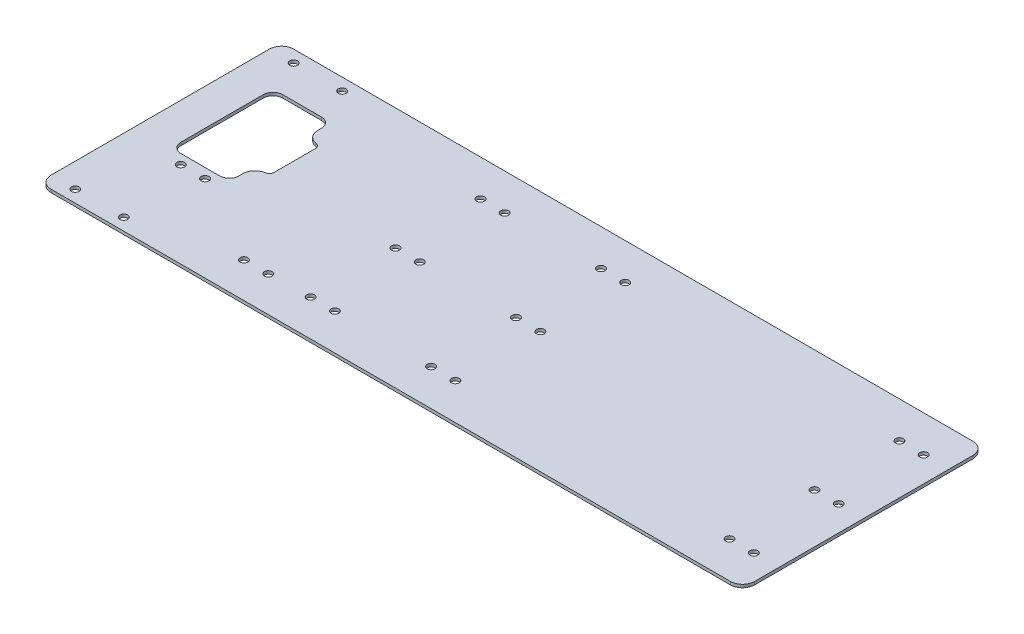
from build123d import *

# Parameters (mm, degrees)
SKETCH1_W           = 368.3
SKETCH1_H           = 127
SKETCH1_R           = 2.032
BOSS_EXTRUDE1_DEPTH = 1.5875
FILLET1_R           = 5.08
FILLET3_R           = 6.35
FILLET4_R           = 2.54
FILLET5_R           = 6.35


with BuildPart() as part:
    # Sketch1 → Boss-Extrude1 (new body)
    with BuildSketch(Plane(origin=(0, 0, 0), x_dir=(1, 0, 0), z_dir=(0, 1, 0))):
        Rectangle(SKETCH1_W, SKETCH1_H)
        with Locations((-171.45, -57.15)):
            Circle(SKETCH1_R, mode=Mode.SUBTRACT)
        with Locations((-146.05, -57.15)):
            Circle(SKETCH1_R, mode=Mode.SUBTRACT)
        with Locations((-95.25, -45.0215)):
            Circle(SKETCH1_R, mode=Mode.SUBTRACT)
        with Locations((-82.55, -45.0215)):
            Circle(SKETCH1_R, mode=Mode.SUBTRACT)
        with Locations((-60.9677978, -44.45)):
            Circle(SKETCH1_R, mode=Mode.SUBTRACT)
        with Locations((-48.2677978, -44.45)):
            Circle(SKETCH1_R, mode=Mode.SUBTRACT)
        with Locations((-154.94, -18.415)):
            Circle(SKETCH1_R, mode=Mode.SUBTRACT)
        with Locations((-142.24, -18.415)):
            Circle(SKETCH1_R, mode=Mode.SUBTRACT)
        with Locations((2.1088604, -44.45)):
            Circle(SKETCH1_R, mode=Mode.SUBTRACT)
        with Locations((14.8088604, -44.45)):
            Circle(SKETCH1_R, mode=Mode.SUBTRACT)
        with Locations((158.3188604, -44.45)):
            Circle(SKETCH1_R, mode=Mode.SUBTRACT)
        with Locations((171.0188604, -44.45)):
            Circle(SKETCH1_R, mode=Mode.SUBTRACT)
        Polygon((-134.618428208, -13.335), (-165.098428208, -13.335), (-165.098428208, 40.005), (-134.618428208, 40.005), (-134.618428208, 26.67), (-126.998428208, 26.67), (-126.998428208, 0), (-134.618428208, 0), align=None, mode=Mode.SUBTRACT)
        with Locations((-60.9677978, 0)):
            Circle(SKETCH1_R, mode=Mode.SUBTRACT)
        with Locations((-48.2677978, 0)):
            Circle(SKETCH1_R, mode=Mode.SUBTRACT)
        with Locations((-171.45, 57.15)):
            Circle(SKETCH1_R, mode=Mode.SUBTRACT)
        with Locations((-146.05, 57.15)):
            Circle(SKETCH1_R, mode=Mode.SUBTRACT)
        with Locations((-60.9677978, 44.45)):
            Circle(SKETCH1_R, mode=Mode.SUBTRACT)
        with Locations((-48.2677978, 44.45)):
            Circle(SKETCH1_R, mode=Mode.SUBTRACT)
        with Locations((2.1088604, 0)):
            Circle(SKETCH1_R, mode=Mode.SUBTRACT)
        with Locations((14.8088604, 0)):
            Circle(SKETCH1_R, mode=Mode.SUBTRACT)
        with Locations((158.3188604, 0)):
            Circle(SKETCH1_R, mode=Mode.SUBTRACT)
        with Locations((171.0188604, 0)):
            Circle(SKETCH1_R, mode=Mode.SUBTRACT)
        with Locations((2.1088604, 44.45)):
            Circle(SKETCH1_R, mode=Mode.SUBTRACT)
        with Locations((14.8088604, 44.45)):
            Circle(SKETCH1_R, mode=Mode.SUBTRACT)
        with Locations((158.3188604, 44.45)):
            Circle(SKETCH1_R, mode=Mode.SUBTRACT)
        with Locations((171.0188604, 44.45)):
            Circle(SKETCH1_R, mode=Mode.SUBTRACT)
    extrude(amount=BOSS_EXTRUDE1_DEPTH)

    # Fillet1
    fillet1_edges = [part.edges().sort_by_distance(p)[0] for p in [
        (-134.618428208, 0.79375, 13.335),
        (-165.098428208, 0.79375, 13.335),
        (-165.098428208, 0.79375, -40.005),
        (-134.618428208, 0.79375, -40.005),
    ]]
    fillet(fillet1_edges, radius=FILLET1_R)

    # Fillet3
    fillet3_edges = [part.edges().sort_by_distance(p)[0] for p in [
        (184.15, 0.79375, 63.5),
        (184.15, 0.79375, -63.5),
        (-184.15, 0.79375, 63.5),
        (-184.15, 0.79375, -63.5),
    ]]
    fillet(fillet3_edges, radius=FILLET3_R)

    # Fillet4
    fillet4_edges = [part.edges().sort_by_distance(p)[0] for p in [
        (-126.998428208, 0.79375, 0),
        (-126.998428208, 0.79375, -26.67),
    ]]
    fillet(fillet4_edges, radius=FILLET4_R)

    # Fillet5
    fillet5_edges = [part.edges().sort_by_distance(p)[0] for p in [
        (-134.618428208, 0.79375, 0),
        (-134.618428208, 0.79375, -26.67),
    ]]
    fillet(fillet5_edges, radius=FILLET5_R)


solid = part.part
